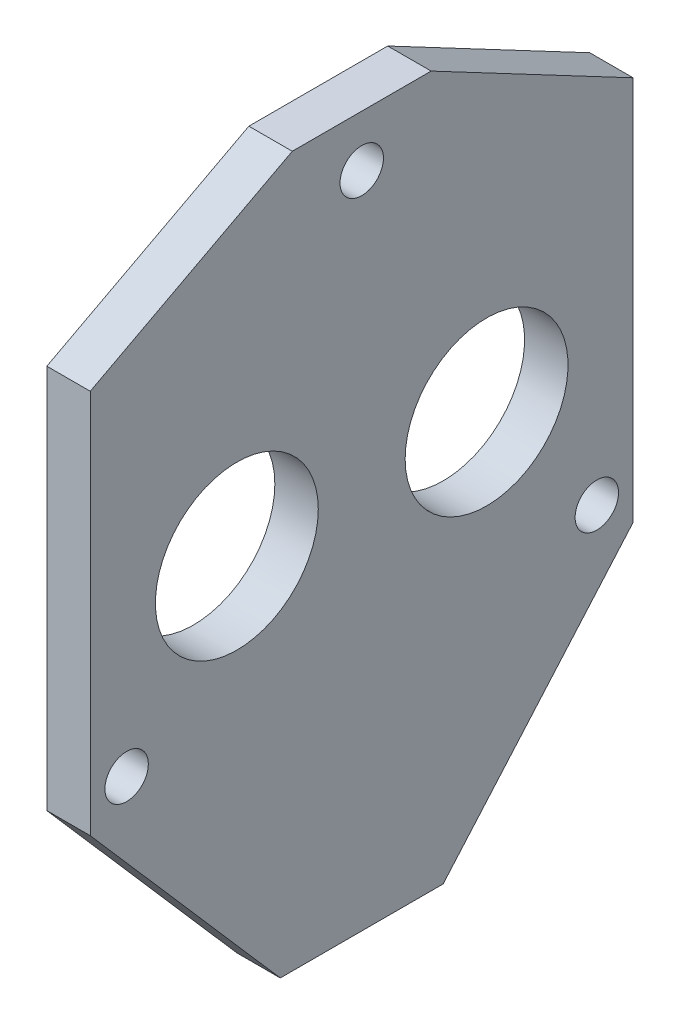
from build123d import *

# Parameters (mm, degrees)
SKETCH1_R           = 4
SKETCH1_R_2         = 15
BOSS_EXTRUDE1_DEPTH = 8


with BuildPart() as part:
    # Sketch1 → Boss-Extrude1 (new body)
    with BuildSketch(Plane(origin=(0, 0, 0), x_dir=(0, 0, -1), z_dir=(1, 0, 0))):
        Polygon((12.78815269, 59.48098672), (-12.78815269, 59.48098672), (-50, 39.802857295), (-50, -31.089777379), (-15, -71.29), (15, -71.29), (50, -31.089777379), (50, 39.802857295), align=None)
        with Locations((0, 50)):
            Circle(SKETCH1_R, mode=Mode.SUBTRACT)
        with Locations((43.301270189, -25)):
            Circle(SKETCH1_R, mode=Mode.SUBTRACT)
        with Locations((-43.301270189, -25)):
            Circle(SKETCH1_R, mode=Mode.SUBTRACT)
        with Locations((-23, 0)):
            Circle(SKETCH1_R_2, mode=Mode.SUBTRACT)
        with Locations((23, 0)):
            Circle(SKETCH1_R_2, mode=Mode.SUBTRACT)
    extrude(amount=BOSS_EXTRUDE1_DEPTH)


solid = part.part
